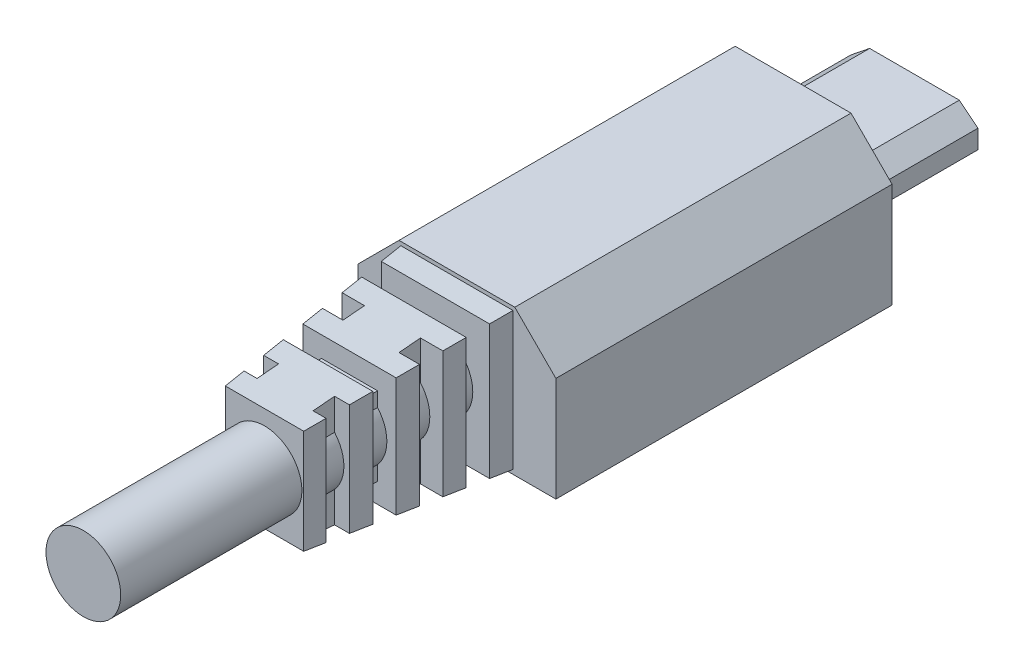
from build123d import *

# Parameters (mm, degrees)
SKETCH1_W           = 3.7
SKETCH1_H           = 0.65
BOSS_EXTRUDE1_DEPTH = 6.5
BOSS_EXTRUDE2_DEPTH = 18
SKETCH5_W           = 6
SKETCH5_H           = 7.371976581
BOSS_EXTRUDE4_DEPTH = 10.3
BOSS_EXTRUDE4_TAPER = 5
SKETCH7_W           = 2.169554373
SKETCH7_H           = 1.15
CUT_EXTRUDE1_DEPTH  = 10.3
SKETCH9_W           = 1.15
SKETCH9_H           = 1.6
CUT_EXTRUDE2_DEPTH  = 10.3
SKETCH3_R           = 2
BOSS_EXTRUDE3_DEPTH = 20


with BuildPart() as part:
    # Sketch1 → Boss-Extrude1 (new body)
    with BuildSketch(Plane.XY):
        Polygon((1, 1.8), (0, 1), (0, 0), (6.8, 0), (6.8, 1), (5.8, 1.8), align=None)
        with Locations((3.4, 0.525)):
            Rectangle(SKETCH1_W, SKETCH1_H, mode=Mode.SUBTRACT)
    extrude(amount=BOSS_EXTRUDE1_DEPTH)

    # Sketch2 → Boss-Extrude2 (add)
    with BuildSketch(Plane.XY.offset(6.5)):
        Polygon((6.5, 4.8), (0.3, 4.8), (-1.9, 2.6), (-1.9, -3), (8.7, -3), (8.7, 2.6), align=None)
    extrude(amount=BOSS_EXTRUDE2_DEPTH)

    # Sketch5 → Boss-Extrude4 (add)
    with BuildSketch(Plane.XY.offset(24.5)):
        with Locations((3.4, 0.91401171)):
            Rectangle(SKETCH5_W, SKETCH5_H)
    extrude(amount=BOSS_EXTRUDE4_DEPTH, taper=BOSS_EXTRUDE4_TAPER)

    # Sketch7 → Cut-Extrude1 (cut)
    with BuildSketch(Plane(origin=(0, 4.8, 0), x_dir=(1, 0, 0), z_dir=(0, 1, 0))):
        with Locations((0.815222814, -26.225)):
            Rectangle(SKETCH7_W, SKETCH7_H)
        with Locations((0.815222814, -28.525)):
            Rectangle(SKETCH7_W, SKETCH7_H)
        with Locations((0.815222814, -30.825)):
            Rectangle(SKETCH7_W, SKETCH7_H)
        with Locations((0.815222814, -33.125)):
            Rectangle(SKETCH7_W, SKETCH7_H)
        with Locations((5.984777187, -33.125)):
            Rectangle(SKETCH7_W, SKETCH7_H)
        with Locations((5.984777187, -30.825)):
            Rectangle(SKETCH7_W, SKETCH7_H)
        with Locations((5.984777187, -28.525)):
            Rectangle(SKETCH7_W, SKETCH7_H)
        with Locations((5.984777187, -26.225)):
            Rectangle(SKETCH7_W, SKETCH7_H)
    extrude(amount=-CUT_EXTRUDE1_DEPTH, mode=Mode.SUBTRACT)

    # Sketch9 → Cut-Extrude2 (cut)
    with BuildSketch(Plane(origin=(8.7, 0, 0), x_dir=(0, 0, -1), z_dir=(1, 0, 0))):
        with Locations((-30.825, -2)):
            Rectangle(SKETCH9_W, SKETCH9_H)
        with Locations((-26.225, -2)):
            Rectangle(SKETCH9_W, SKETCH9_H)
        with Locations((-26.225, 3.8)):
            Rectangle(SKETCH9_W, SKETCH9_H)
        with Locations((-30.825, 3.8)):
            Rectangle(SKETCH9_W, SKETCH9_H)
    extrude(amount=-CUT_EXTRUDE2_DEPTH, mode=Mode.SUBTRACT)

    # Sketch3 → Boss-Extrude3 (add)
    with BuildSketch(Plane.XY.offset(24.5)):
        with Locations((3.4, 0.9)):
            Circle(SKETCH3_R)
    extrude(amount=BOSS_EXTRUDE3_DEPTH)


solid = part.part
